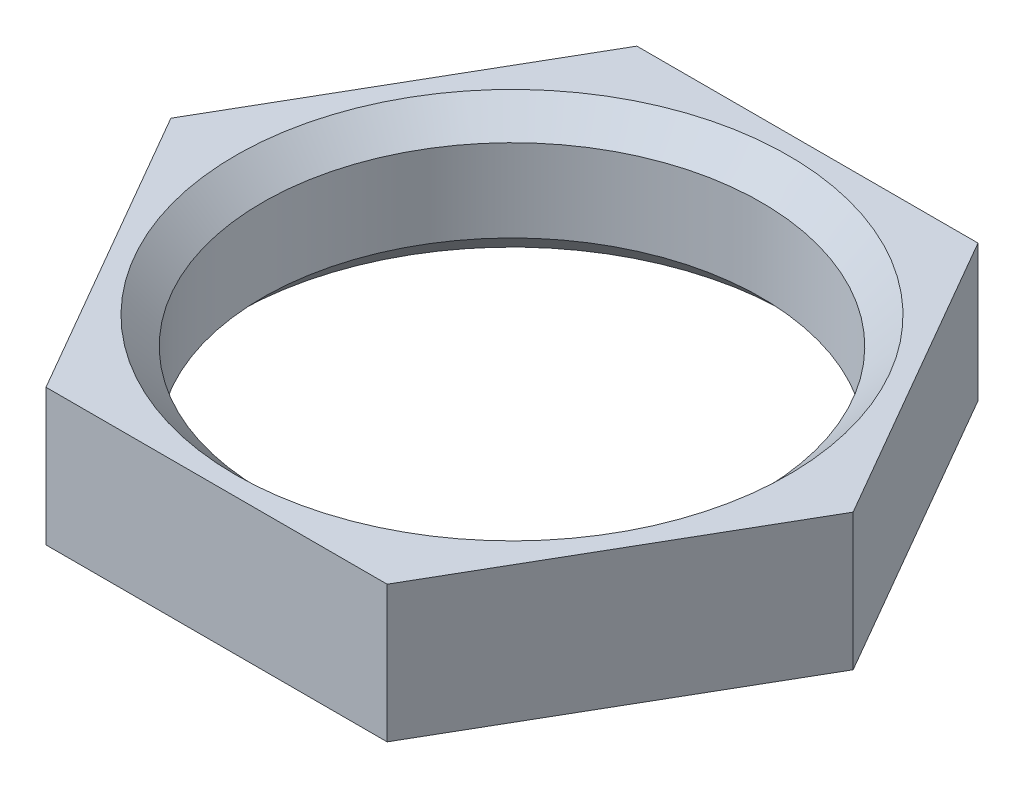
from build123d import *

# Parameters (mm, degrees)
BOSS_EXTRUDE1_DEPTH = 2.5654
SKETCH7_R           = 4.6863
CUT_EXTRUDE1_DEPTH  = 9.857267478
FILLET1_SIZE        = 0.508
FILLET2_SIZE        = 0.508


with BuildPart() as part:
    # Sketch4 → Boss-Extrude1 (new body)
    with BuildSketch(Plane(origin=(0, 0, 0), x_dir=(1, 0, 0), z_dir=(0, 1, 0))):
        Polygon((6.408472518, 0), (3.204236259, 5.5499), (-3.204236259, 5.5499), (-6.408472518, 0), (-3.204236259, -5.5499), (3.204236259, -5.5499), align=None)
    extrude(amount=BOSS_EXTRUDE1_DEPTH)

    # Sketch7 → Cut-Extrude1 (cut, through all)
    with BuildSketch(Plane(origin=(0, 2.5654, 0), x_dir=(1, 0, 0), z_dir=(0, 1, 0))):
        Circle(SKETCH7_R)
    extrude(amount=-CUT_EXTRUDE1_DEPTH, mode=Mode.SUBTRACT)

    # Fillet1
    fillet1_edges = [part.edges().sort_by_distance(p)[0] for p in [
        (-4.6863, 2.5654, 0),
    ]]
    chamfer(fillet1_edges, length=FILLET1_SIZE)

    # Fillet2
    fillet2_edges = [part.edges().sort_by_distance(p)[0] for p in [
        (-4.6863, 0, 0),
    ]]
    chamfer(fillet2_edges, length=FILLET2_SIZE)


solid = part.part
